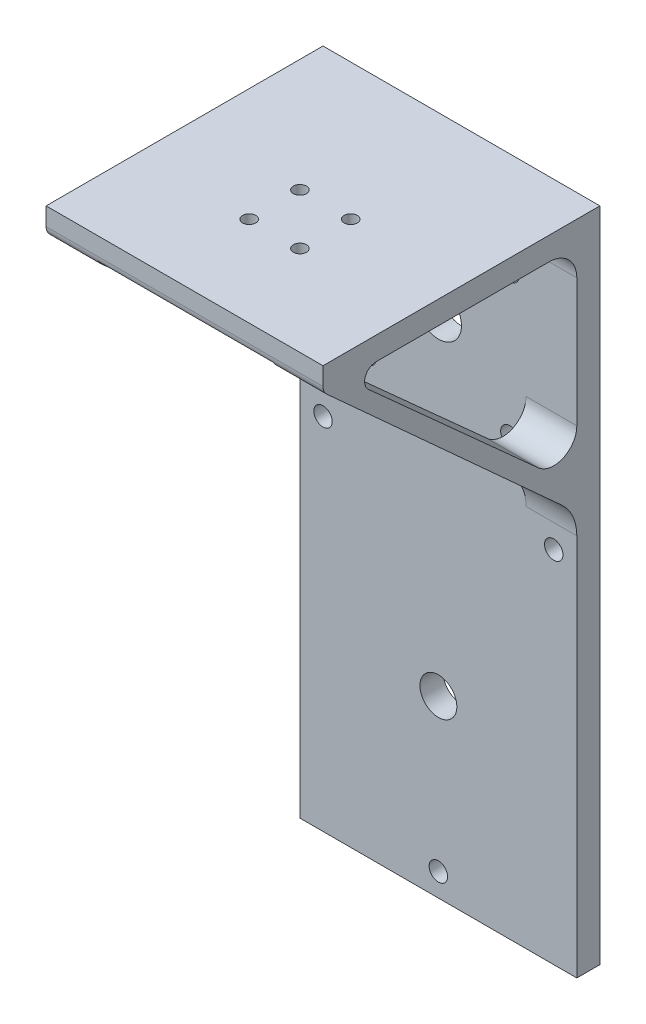
from build123d import *

# Parameters (mm, degrees)
BOSS_EXTRUDE1_DEPTH = 60
CUT_EXTRUDE2_REACH  = 161.501
SKETCH2_R           = 1.425
CUT_EXTRUDE3_REACH  = 115.849
SKETCH10_R          = 5
SKETCH10_R_2        = 4
SKETCH10_R_3        = 2
BOSS_EXTRUDE2_DEPTH = 11
BOSS_EXTRUDE3_DEPTH = 11
FILLET2_R           = 10
FILLET3_R           = 10
FILLET4_R           = 5
FILLET5_R           = 5
FILLET6_R           = 2.5
FILLET7_R           = 2.5
FILLET8_START       = -61
FILLET8_DEPTH       = 62
FILLET9_R           = 6


with BuildPart() as part:
    # Sketch1 → Boss-Extrude1 (new body)
    with BuildSketch(Plane(origin=(0, 0, 0), x_dir=(0, 0, -1), z_dir=(1, 0, 0))):
        Polygon((-20.469264339, 61.494964584), (-20.469264339, 66.494964584), (39.530735661, 66.494964584), (39.530735661, -75.905035416), (34.530735661, -75.905035416), (34.530735661, 61.494964584), align=None)
    extrude(amount=-BOSS_EXTRUDE1_DEPTH)

    # Sketch2 → Cut-Extrude2 (cut, up to next)
    with BuildSketch(Plane(origin=(0, 66.494964584, 0), x_dir=(1, 0, 0), z_dir=(0, 1, 0)), mode=Mode.PRIVATE) as cut_extrude2_sk1:
        with Locations(Location((-35.5, 10.030735661, 0), (0, 0, 270))):
            Circle(SKETCH2_R)
    cut_extrude2_tool1 = extrude(cut_extrude2_sk1.sketch, amount=-CUT_EXTRUDE2_REACH, mode=Mode.PRIVATE) & part.part
    # Sketch2 → Cut-Extrude2 (cut, up to next)
    with BuildSketch(Plane(origin=(0, 66.494964584, 0), x_dir=(1, 0, 0), z_dir=(0, 1, 0)), mode=Mode.PRIVATE) as cut_extrude2_sk2:
        with Locations(Location((-24.5, 10.030735661, 0), (0, 0, 270))):
            Circle(SKETCH2_R)
    cut_extrude2_tool2 = extrude(cut_extrude2_sk2.sketch, amount=-CUT_EXTRUDE2_REACH, mode=Mode.PRIVATE) & part.part
    # Sketch2 → Cut-Extrude2 (cut, up to next)
    with BuildSketch(Plane(origin=(0, 66.494964584, 0), x_dir=(1, 0, 0), z_dir=(0, 1, 0)), mode=Mode.PRIVATE) as cut_extrude2_sk3:
        with Locations(Location((-24.5, -0.969264339, 0), (0, 0, 270))):
            Circle(SKETCH2_R)
    cut_extrude2_tool3 = extrude(cut_extrude2_sk3.sketch, amount=-CUT_EXTRUDE2_REACH, mode=Mode.PRIVATE) & part.part
    # Sketch2 → Cut-Extrude2 (cut, up to next)
    with BuildSketch(Plane(origin=(0, 66.494964584, 0), x_dir=(1, 0, 0), z_dir=(0, 1, 0)), mode=Mode.PRIVATE) as cut_extrude2_sk4:
        with Locations(Location((-35.5, -0.969264339, 0), (0, 0, 270))):
            Circle(SKETCH2_R)
    cut_extrude2_tool4 = extrude(cut_extrude2_sk4.sketch, amount=-CUT_EXTRUDE2_REACH, mode=Mode.PRIVATE) & part.part
    add(cut_extrude2_tool1.solids().sort_by_distance((-35.5, 66.494965, -10.030736))[0], mode=Mode.SUBTRACT)
    add(cut_extrude2_tool2.solids().sort_by_distance((-24.5, 66.494965, -10.030736))[0], mode=Mode.SUBTRACT)
    add(cut_extrude2_tool3.solids().sort_by_distance((-24.5, 66.494965, 0.969264))[0], mode=Mode.SUBTRACT)
    add(cut_extrude2_tool4.solids().sort_by_distance((-35.5, 66.494965, 0.969264))[0], mode=Mode.SUBTRACT)

    # Sketch10 → Cut-Extrude3 (cut, up to next)
    with BuildSketch(Plane(origin=(0, 0, -39.530735661), x_dir=(-1, 0, 0), z_dir=(0, 0, -1)), mode=Mode.PRIVATE) as cut_extrude3_sk1:
        with Locations(Location((30, 33.994964584, 0), (0, 0, 90))):
            Circle(SKETCH10_R)
    cut_extrude3_tool1 = extrude(cut_extrude3_sk1.sketch, amount=-CUT_EXTRUDE3_REACH, mode=Mode.PRIVATE) & part.part
    # Sketch10 → Cut-Extrude3 (cut, up to next)
    with BuildSketch(Plane(origin=(0, 0, -39.530735661), x_dir=(-1, 0, 0), z_dir=(0, 0, -1)), mode=Mode.PRIVATE) as cut_extrude3_sk2:
        with Locations(Location((30, -38.005035416, 0), (0, 0, 90))):
            Circle(SKETCH10_R_2)
    cut_extrude3_tool2 = extrude(cut_extrude3_sk2.sketch, amount=-CUT_EXTRUDE3_REACH, mode=Mode.PRIVATE) & part.part
    # Sketch10 → Cut-Extrude3 (cut, up to next)
    with BuildSketch(Plane(origin=(0, 0, -39.530735661), x_dir=(-1, 0, 0), z_dir=(0, 0, -1)), mode=Mode.PRIVATE) as cut_extrude3_sk3:
        with Locations(Location((14.5, 49.494964584, 0), (0, 0, 90))):
            Circle(SKETCH10_R_3)
    cut_extrude3_tool3 = extrude(cut_extrude3_sk3.sketch, amount=-CUT_EXTRUDE3_REACH, mode=Mode.PRIVATE) & part.part
    # Sketch10 → Cut-Extrude3 (cut, up to next)
    with BuildSketch(Plane(origin=(0, 0, -39.530735661), x_dir=(-1, 0, 0), z_dir=(0, 0, -1)), mode=Mode.PRIVATE) as cut_extrude3_sk4:
        with Locations(Location((14.5, 18.494964584, 0), (0, 0, 90))):
            Circle(SKETCH10_R_3)
    cut_extrude3_tool4 = extrude(cut_extrude3_sk4.sketch, amount=-CUT_EXTRUDE3_REACH, mode=Mode.PRIVATE) & part.part
    # Sketch10 → Cut-Extrude3 (cut, up to next)
    with BuildSketch(Plane(origin=(0, 0, -39.530735661), x_dir=(-1, 0, 0), z_dir=(0, 0, -1)), mode=Mode.PRIVATE) as cut_extrude3_sk5:
        with Locations(Location((45.5, 18.494964584, 0), (0, 0, 90))):
            Circle(SKETCH10_R_3)
    cut_extrude3_tool5 = extrude(cut_extrude3_sk5.sketch, amount=-CUT_EXTRUDE3_REACH, mode=Mode.PRIVATE) & part.part
    # Sketch10 → Cut-Extrude3 (cut, up to next)
    with BuildSketch(Plane(origin=(0, 0, -39.530735661), x_dir=(-1, 0, 0), z_dir=(0, 0, -1)), mode=Mode.PRIVATE) as cut_extrude3_sk6:
        with Locations(Location((45.5, 49.494964584, 0), (0, 0, 90))):
            Circle(SKETCH10_R_3)
    cut_extrude3_tool6 = extrude(cut_extrude3_sk6.sketch, amount=-CUT_EXTRUDE3_REACH, mode=Mode.PRIVATE) & part.part
    # Sketch10 → Cut-Extrude3 (cut, up to next)
    with BuildSketch(Plane(origin=(0, 0, -39.530735661), x_dir=(-1, 0, 0), z_dir=(0, 0, -1)), mode=Mode.PRIVATE) as cut_extrude3_sk7:
        with Locations(Location((5, 1.994964584, 0), (0, 0, 90))):
            Circle(SKETCH10_R_3)
    cut_extrude3_tool7 = extrude(cut_extrude3_sk7.sketch, amount=-CUT_EXTRUDE3_REACH, mode=Mode.PRIVATE) & part.part
    # Sketch10 → Cut-Extrude3 (cut, up to next)
    with BuildSketch(Plane(origin=(0, 0, -39.530735661), x_dir=(-1, 0, 0), z_dir=(0, 0, -1)), mode=Mode.PRIVATE) as cut_extrude3_sk8:
        with Locations(Location((55, 1.994964584, 0), (0, 0, 90))):
            Circle(SKETCH10_R_3)
    cut_extrude3_tool8 = extrude(cut_extrude3_sk8.sketch, amount=-CUT_EXTRUDE3_REACH, mode=Mode.PRIVATE) & part.part
    # Sketch10 → Cut-Extrude3 (cut, up to next)
    with BuildSketch(Plane(origin=(0, 0, -39.530735661), x_dir=(-1, 0, 0), z_dir=(0, 0, -1)), mode=Mode.PRIVATE) as cut_extrude3_sk9:
        with Locations(Location((30, -70.905035416, 0), (0, 0, 90))):
            Circle(SKETCH10_R_3)
    cut_extrude3_tool9 = extrude(cut_extrude3_sk9.sketch, amount=-CUT_EXTRUDE3_REACH, mode=Mode.PRIVATE) & part.part
    add(cut_extrude3_tool1.solids().sort_by_distance((-30, 33.994965, -39.530736))[0], mode=Mode.SUBTRACT)
    add(cut_extrude3_tool2.solids().sort_by_distance((-30, -38.005035, -39.530736))[0], mode=Mode.SUBTRACT)
    add(cut_extrude3_tool3.solids().sort_by_distance((-14.5, 49.494965, -39.530736))[0], mode=Mode.SUBTRACT)
    add(cut_extrude3_tool4.solids().sort_by_distance((-14.5, 18.494965, -39.530736))[0], mode=Mode.SUBTRACT)
    add(cut_extrude3_tool5.solids().sort_by_distance((-45.5, 18.494965, -39.530736))[0], mode=Mode.SUBTRACT)
    add(cut_extrude3_tool6.solids().sort_by_distance((-45.5, 49.494965, -39.530736))[0], mode=Mode.SUBTRACT)
    add(cut_extrude3_tool7.solids().sort_by_distance((-5, 1.994965, -39.530736))[0], mode=Mode.SUBTRACT)
    add(cut_extrude3_tool8.solids().sort_by_distance((-55, 1.994965, -39.530736))[0], mode=Mode.SUBTRACT)
    add(cut_extrude3_tool9.solids().sort_by_distance((-30, -70.905035, -39.530736))[0], mode=Mode.SUBTRACT)

    # Sketch11 → Boss-Extrude2 (add)
    with BuildSketch(Plane(origin=(0, 0, 0), x_dir=(0, 0, -1), z_dir=(1, 0, 0))):
        Polygon((-15.469264339, 61.494964584), (34.530735661, 16.494964584), (34.530735661, 11.494964584), (-20.469264339, 61.494964584), align=None)
    extrude(amount=-BOSS_EXTRUDE2_DEPTH)

    # Sketch13 → Boss-Extrude3 (add)
    with BuildSketch(Plane.ZY.offset(60)):
        Polygon((-34.530735661, 11.494964584), (-34.530735661, 16.494964584), (15.469264339, 61.494964584), (20.469264339, 61.494964584), align=None)
    extrude(amount=-BOSS_EXTRUDE3_DEPTH)

    # Fillet2
    fillet2_edges = [part.edges().sort_by_distance(p)[0] for p in [
        (-54.5, 11.494964584, -34.530735661),
    ]]
    fillet(fillet2_edges, radius=FILLET2_R)

    # Fillet3
    fillet3_edges = [part.edges().sort_by_distance(p)[0] for p in [
        (-5.5, 11.494964584, -34.530735661),
    ]]
    fillet(fillet3_edges, radius=FILLET3_R)

    # Fillet4
    fillet4_edges = [part.edges().sort_by_distance(p)[0] for p in [
        (-5.5, 16.494964584, -34.530735661),
    ]]
    fillet(fillet4_edges, radius=FILLET4_R)

    # Fillet5
    fillet5_edges = [part.edges().sort_by_distance(p)[0] for p in [
        (-54.5, 16.494964584, -34.530735661),
    ]]
    fillet(fillet5_edges, radius=FILLET5_R)

    # Fillet6
    fillet6_edges = [part.edges().sort_by_distance(p)[0] for p in [
        (-54.5, 61.494964584, 15.469264339),
    ]]
    fillet(fillet6_edges, radius=FILLET6_R)

    # Fillet7
    fillet7_edges = [part.edges().sort_by_distance(p)[0] for p in [
        (-5.5, 61.494964584, 15.469264339),
    ]]
    fillet(fillet7_edges, radius=FILLET7_R)

    # Fillet8: read off the stored shape, not the designer's step
    # Fillet8 outline → Fillet8 (cut)
    with BuildSketch(Plane.YZ.offset(FILLET8_START)):
        with BuildLine():
            Line((61.494964584, 20.469264339), (60.751039115, 19.650946324))
            ThreePointArc((60.751039115, 19.650946324), (61.589505337, 20.255550078), (62.600889299, 20.469264339))
            Line((62.600889299, 20.469264339), (61.494964584, 20.469264339))
        make_face()
    extrude(amount=FILLET8_DEPTH, mode=Mode.SUBTRACT)

    # Fillet9
    fillet9_edges = [part.edges().sort_by_distance(p)[0] for p in [
        (-30, 61.494964584, -34.530735661),
    ]]
    fillet(fillet9_edges, radius=FILLET9_R)


solid = part.part
